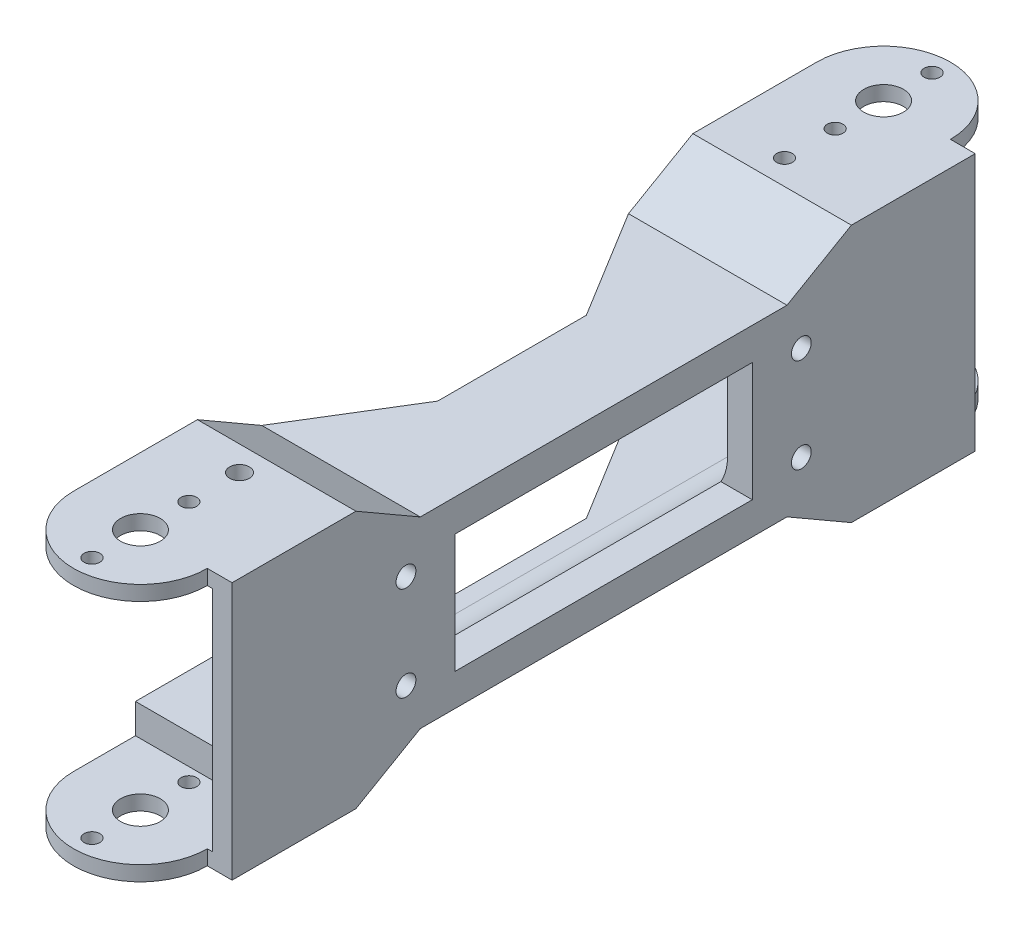
from build123d import *

# Parameters (mm, degrees)
SKETCH1_R                             = 2
BOSS_EXTRUDE1_DEPTH                   = 26
CUT_EXTRUDE1_DEPTH                    = 97.110613358
CUT_EXTRUDE2_DEPTH                    = 97.110613358
CUT_EXTRUDE2_DEPTH_BACK               = 97.110613358
SKETCH4_W                             = 26
SKETCH4_H                             = 6
SKETCH5_W                             = 177
SKETCH5_H                             = 34
CUT_EXTRUDE3_DEPTH                    = 22
SKETCH6_W                             = 22.988088482
SKETCH6_H                             = 34
CUT_EXTRUDE4_DEPTH                    = 95.827474922
SKETCH7_W                             = 22.988088482
SKETCH7_H                             = 34
CUT_EXTRUDE5_DEPTH                    = 95.827474922
F_1_8_0_125_DIAMETER_HOLE1_AT_2_COUNT = 2
F_1_8_0_125_DIAMETER_HOLE1_AT_2_PITCH = 19.558
SKETCH13_R                            = 4
CUT_EXTRUDE6_DEPTH                    = 104.530188834
BOSS_EXTRUDE2_DEPTH                   = 5
SKETCH15_W                            = 125
SKETCH15_H                            = 34
CUT_EXTRUDE7_DEPTH                    = 5
SKETCH17_W                            = 4
SKETCH17_H                            = 52
BOSS_EXTRUDE4_DEPTH                   = 12.5
SKETCH19_R                            = 2
CUT_EXTRUDE11_DEPTH                   = 10
CUT_EXTRUDE8_REACH                    = 106.3
SKETCH18_R                            = 1.5875
SKETCH20_W                            = 60
SKETCH20_H                            = 24
CUT_EXTRUDE10_DEPTH                   = 10
CUT_EXTRUDE12_REACH                   = 102.771
SKETCH22_W                            = 5
SKETCH22_H                            = 46
BOSS_EXTRUDE5_DEPTH                   = 12.5
FILLET1_R                             = 10


with BuildPart() as part:
    # Sketch1 → Boss-Extrude1 (new, symmetric)
    with BuildSketch(Plane(origin=(0, 0, 0), x_dir=(1, 0, 0), z_dir=(0, 1, 0))):
        with BuildLine():
            Line((-13.5, 75), (-13.5, -75))
            ThreePointArc((-13.5, -75), (0, -88.5), (13.5, -75))
            Line((13.5, -75), (13.5, 75))
            ThreePointArc((13.5, 75), (0, 88.5), (-13.5, 75))
        make_face()
        with Locations(Location((0, -55, 0), (0, 0, 90))):
            Circle(SKETCH1_R, mode=Mode.SUBTRACT)
    extrude(amount=BOSS_EXTRUDE1_DEPTH, both=True)

    # Sketch3 → Cut-Extrude1 (cut, symmetric)
    with BuildSketch(Plane.ZY.offset(13.5)):
        Polygon((-50, 26), (-37.009618943, 18.5), (37.009618943, 18.5), (50, 26), align=None)
    cut_extrude1 = extrude(amount=CUT_EXTRUDE1_DEPTH, both=True, mode=Mode.SUBTRACT)

    # Mirror1: Cut-Extrude1 across plane
    add(cut_extrude1.mirror(Plane.ZX), mode=Mode.SUBTRACT)

    # Sketch4 → Cut-Extrude2 (cut, two sides: drawn at the far end of the back side and taken through both)
    with BuildSketch(Plane.ZY.offset(13.5).offset(-CUT_EXTRUDE2_DEPTH_BACK)):
        with Locations((75.5, 20)):
            Rectangle(SKETCH4_W, SKETCH4_H)
        with Locations((-75.5, 20)):
            Rectangle(SKETCH4_W, SKETCH4_H)
        with Locations((-75.5, -20)):
            Rectangle(SKETCH4_W, SKETCH4_H)
        with Locations((75.5, -20)):
            Rectangle(SKETCH4_W, SKETCH4_H)
    extrude(amount=CUT_EXTRUDE2_DEPTH + CUT_EXTRUDE2_DEPTH_BACK, mode=Mode.SUBTRACT)

    # Sketch5 → Cut-Extrude3 (cut)
    with BuildSketch(Plane.ZY.offset(13.5)):
        Rectangle(SKETCH5_W, SKETCH5_H)
    extrude(amount=-CUT_EXTRUDE3_DEPTH, mode=Mode.SUBTRACT)

    # Sketch6 → Cut-Extrude4 (cut, through all)
    with BuildSketch(Plane.ZY.offset(-8.5)):
        with Locations((73.994044241, 0)):
            Rectangle(SKETCH6_W, SKETCH6_H)
    extrude(amount=-CUT_EXTRUDE4_DEPTH, mode=Mode.SUBTRACT)

    # Sketch7 → Cut-Extrude5 (cut, through all)
    with BuildSketch(Plane.ZY.offset(-8.5)):
        with Locations((-73.994044241, 0)):
            Rectangle(SKETCH7_W, SKETCH7_H)
    extrude(amount=-CUT_EXTRUDE5_DEPTH, mode=Mode.SUBTRACT)

    # Sketch12 → 1/8 (0.125) Diameter Hole1 (revolve, cut)
    with BuildSketch(Plane(origin=(0, 26, 65.221), x_dir=(0, 0, 1), z_dir=(1, 0, 0))):
        Polygon((0, 0), (0, 3.953866233), (1.5875, 3), (1.5875, 0), align=None)
    f_1_8_0_125_diameter_hole1 = revolve(axis=Axis((0, 32.35, 65.221), (0, -1, 0)), mode=Mode.SUBTRACT)

    # 1/8 (0.125) Diameter Hole1 at 2: 1/8 (0.125) Diameter Hole1 ×2
    with Locations(*[(0, 0, i * F_1_8_0_125_DIAMETER_HOLE1_AT_2_PITCH) for i in range(1, F_1_8_0_125_DIAMETER_HOLE1_AT_2_COUNT)]):
        add(f_1_8_0_125_diameter_hole1, mode=Mode.SUBTRACT)

    # Mirror5: 1/8 (0.125) Diameter Hole1 across plane
    add(f_1_8_0_125_diameter_hole1.mirror(Plane.ZX), mode=Mode.SUBTRACT)

    # Mirror5 copy 1 sketch → Mirror5 copy 1 (revolve, cut)
    with BuildSketch(Plane(origin=(0, -26, 84.779), x_dir=(0, 0, 1), z_dir=(1, 0, 0))):
        Polygon((0, 0), (0, -3.953866233), (1.5875, -3), (1.5875, 0), align=None)
    revolve(axis=Axis((0, -32.35, 84.779), (0, -1, 0)), mode=Mode.SUBTRACT)

    # Mirror3: 1/8 (0.125) Diameter Hole1 across plane
    add(f_1_8_0_125_diameter_hole1.mirror(Plane.XY), mode=Mode.SUBTRACT)

    # Mirror3 copy 1 sketch → Mirror3 copy 1 (revolve, cut)
    with BuildSketch(Plane(origin=(0, 26, -84.779), x_dir=(0, 0, -1), z_dir=(1, 0, 0))):
        Polygon((0, 0), (0, -3.953866233), (1.5875, -3), (1.5875, 0), align=None)
    revolve(axis=Axis((0, 32.35, -84.779), (0, 1, 0)), mode=Mode.SUBTRACT)

    # Sketch13 → Cut-Extrude6 (cut, symmetric)
    with BuildSketch(Plane.XZ.offset(26)):
        with Locations(Location((0, -75, 0), (0, 0, 270))):
            Circle(SKETCH13_R)
    cut_extrude6 = extrude(amount=CUT_EXTRUDE6_DEPTH, both=True, mode=Mode.SUBTRACT)

    # Mirror4: Cut-Extrude6 across plane
    add(cut_extrude6.mirror(Plane.XY), mode=Mode.SUBTRACT)

    # Sketch14 → Boss-Extrude2 (add)
    with BuildSketch(Plane(origin=(13.5, 0, 0), x_dir=(0, 0, -1), z_dir=(1, 0, 0))):
        Polygon((-75, 26), (-75, 23), (-62.5, 23), (-62.5, -23), (-75, -23), (-75, -26), (-50, -26), (-37.009618943, -18.5), (37.009618943, -18.5), (50, -26), (75, -26), (75, -23), (62.5, -23), (62.5, 23), (75, 23), (75, 26), (50, 26), (37.009618943, 18.5), (-37.009618943, 18.5), (-50, 26), align=None)
    extrude(amount=BOSS_EXTRUDE2_DEPTH)

    # Sketch15 → Cut-Extrude7 (cut)
    with BuildSketch(Plane.ZY.offset(-8.5)):
        Rectangle(SKETCH15_W, SKETCH15_H)
    extrude(amount=-CUT_EXTRUDE7_DEPTH, mode=Mode.SUBTRACT)

    # Sketch17 → Boss-Extrude4 (add)
    with BuildSketch(Plane.XY.offset(62.5)):
        with Locations((16.5, 0)):
            Rectangle(SKETCH17_W, SKETCH17_H)
    extrude(amount=BOSS_EXTRUDE4_DEPTH)

    # Mirror6 copy 1 sketch → Mirror6 copy 1 (revolve, cut)
    with BuildSketch(Plane(origin=(0, -26, -65.221), x_dir=(0, 0, -1), z_dir=(1, 0, 0))):
        Polygon((0, 0), (0, 3.953866233), (1.5875, 3), (1.5875, 0), align=None)
    revolve(axis=Axis((0, -32.35, -65.221), (0, 1, 0)), mode=Mode.SUBTRACT)

    # Mirror6 copy 2 sketch → Mirror6 copy 2 (revolve, cut)
    with BuildSketch(Plane(origin=(0, -26, -84.779), x_dir=(0, 0, -1), z_dir=(1, 0, 0))):
        Polygon((0, 0), (0, 3.953866233), (1.5875, 3), (1.5875, 0), align=None)
    revolve(axis=Axis((0, -32.35, -84.779), (0, 1, 0)), mode=Mode.SUBTRACT)

    # Mirror6 copy 3 sketch → Mirror6 copy 3 (revolve, cut)
    with BuildSketch(Plane(origin=(0, -26, 65.221), x_dir=(0, 0, 1), z_dir=(1, 0, 0))):
        Polygon((0, 0), (0, -3.953866233), (1.5875, -3), (1.5875, 0), align=None)
    revolve(axis=Axis((0, -32.35, 65.221), (0, -1, 0)), mode=Mode.SUBTRACT)

    # Mirror6 copy 4 sketch → Mirror6 copy 4 (revolve, cut)
    with BuildSketch(Plane(origin=(0, -26, 84.779), x_dir=(0, 0, 1), z_dir=(1, 0, 0))):
        Polygon((0, 0), (0, -3.953866233), (1.5875, -3), (1.5875, 0), align=None)
    revolve(axis=Axis((0, -32.35, 84.779), (0, -1, 0)), mode=Mode.SUBTRACT)

    # Sketch19 → Cut-Extrude11 (cut)
    with BuildSketch(Plane(origin=(18.5, 0, 0), x_dir=(0, 0, -1), z_dir=(1, 0, 0))):
        with Locations((-39.898979486, 9.525)):
            Circle(SKETCH19_R)
        with Locations((-39.898979486, -9.525)):
            Circle(SKETCH19_R)
    cut_extrude11 = extrude(amount=-CUT_EXTRUDE11_DEPTH, mode=Mode.SUBTRACT)

    # Cut-Extrude8: up to this face of the body (flat: up to its plane)
    cut_extrude8_end = Plane(part.part.faces().sort_by_distance((1.960443083, -26, -66.805592971))[0])
    # Sketch18 → Cut-Extrude8 (cut, up to the picked face)
    with BuildSketch(Plane(origin=(0, 26, 0), x_dir=(1, 0, 0), z_dir=(0, 1, 0)), mode=Mode.PRIVATE) as cut_extrude8_sk1:
        with Locations(Location((0, 55, 0), (0, 0, 270))):
            Circle(SKETCH18_R)
    cut_extrude8_tool1 = split(extrude(cut_extrude8_sk1.sketch, amount=-CUT_EXTRUDE8_REACH, mode=Mode.PRIVATE), bisect_by=cut_extrude8_end, keep=Keep.BOTH, mode=Mode.PRIVATE)
    add(cut_extrude8_tool1.solids().sort_by(Axis((0, 26, -55), (0, -1, 0)))[0], mode=Mode.SUBTRACT)

    # Sketch20 → Cut-Extrude10 (cut)
    with BuildSketch(Plane.ZY.offset(-13.5)):
        Rectangle(SKETCH20_W, SKETCH20_H)
    extrude(amount=-CUT_EXTRUDE10_DEPTH, mode=Mode.SUBTRACT)

    # Mirror7: Cut-Extrude11 across plane
    add(cut_extrude11.mirror(Plane.XY), mode=Mode.SUBTRACT)

    # Sketch21 → Cut-Extrude12 (cut, up to next)
    with BuildSketch(Plane(origin=(0, 18.5, 0), x_dir=(1, 0, 0), z_dir=(0, 1, 0)), mode=Mode.PRIVATE) as cut_extrude12_sk1:
        Polygon((-13.5, 37.009618943), (0, 15), (0, -15), (-13.5, -37.009618943), align=None)
    cut_extrude12_tool1 = extrude(cut_extrude12_sk1.sketch, amount=-CUT_EXTRUDE12_REACH, mode=Mode.PRIVATE) & part.part
    add(cut_extrude12_tool1.solids().sort_by_distance((-7.702163, 18.5, 0))[0], mode=Mode.SUBTRACT)
    add(cut_extrude12_tool1.solids().sort_by_distance((-7.702163, 18.5, 0))[1], mode=Mode.SUBTRACT)

    # Sketch22 → Boss-Extrude5 (add)
    with BuildSketch(Plane(origin=(0, 0, -62.5), x_dir=(-1, 0, 0), z_dir=(0, 0, -1))):
        with Locations((-16, 0)):
            Rectangle(SKETCH22_W, SKETCH22_H)
    extrude(amount=BOSS_EXTRUDE5_DEPTH)

    # Fillet1
    # the kernel refuses this fillet: 10 mm, written as the material it adds along each edge
    with BuildSketch(Plane(origin=(13.5, 17, -62.5), x_dir=(0, -1, 0), z_dir=(0, 0, 1))) as fillet1_piece_1_section:
        with BuildLine():
            CenterArc((FILLET1_R, -FILLET1_R), FILLET1_R, 90, 90)
            Line((0, -FILLET1_R), (0, 0))
            Line((0, 0), (FILLET1_R, 0))
        make_face()
    fillet1_piece_1 = extrude(amount=150, mode=Mode.PRIVATE)
    fillet1_piece_1 = fillet1_piece_1 - Plane(origin=(13.095089825, 9.525, -39.898979486), x_dir=(0, 0, 1), z_dir=(1, 0, 0)) * Cylinder(2, 341, mode=Mode.PRIVATE)
    fillet1_piece_1 = split(fillet1_piece_1, bisect_by=Plane(origin=(13.095089825, 10.807057583, -30), z_dir=(0, 0, -1)), keep=Keep.TOP, mode=Mode.PRIVATE)
    add(fillet1_piece_1)
    with BuildSketch(Plane(origin=(13.5, 17, -62.5), x_dir=(0, -1, 0), z_dir=(0, 0, 1))) as fillet1_piece_2_section:
        with BuildLine():
            CenterArc((FILLET1_R, -FILLET1_R), FILLET1_R, 90, 90)
            Line((0, -FILLET1_R), (0, 0))
            Line((0, 0), (FILLET1_R, 0))
        make_face()
    fillet1_piece_2 = extrude(amount=125, mode=Mode.PRIVATE)
    fillet1_piece_2 = split(fillet1_piece_2, bisect_by=Plane(origin=(11.059751506, 12, 0), z_dir=(0, 1, 0)), keep=Keep.TOP, mode=Mode.PRIVATE)
    add(fillet1_piece_2)
    with BuildSketch(Plane(origin=(13.5, 17, -87.5), x_dir=(0, -1, 0), z_dir=(0, 0, 1))) as fillet1_piece_3_section:
        with BuildLine():
            CenterArc((FILLET1_R, -FILLET1_R), FILLET1_R, 90, 90)
            Line((0, -FILLET1_R), (0, 0))
            Line((0, 0), (FILLET1_R, 0))
        make_face()
    fillet1_piece_3 = extrude(amount=150, mode=Mode.PRIVATE)
    fillet1_piece_3 = fillet1_piece_3 - Plane(origin=(13.095089825, 9.525, 39.898979486), x_dir=(0, 0, -1), z_dir=(1, 0, 0)) * Cylinder(2, 341, mode=Mode.PRIVATE)
    fillet1_piece_3 = split(fillet1_piece_3, bisect_by=Plane(origin=(13.095089825, 10.807057583, 30), z_dir=(0, 0, 1)), keep=Keep.TOP, mode=Mode.PRIVATE)
    add(fillet1_piece_3)
    with BuildSketch(Plane(origin=(13.5, -17, 62.5), x_dir=(-1, 0, 0), z_dir=(0, 0, -1))) as fillet1_piece_4_section:
        with BuildLine():
            CenterArc((FILLET1_R, FILLET1_R), FILLET1_R, 180, 90)
            Line((0, FILLET1_R), (0, 0))
            Line((0, 0), (FILLET1_R, 0))
        make_face()
    fillet1_piece_4 = extrude(amount=125, mode=Mode.PRIVATE)
    fillet1_piece_4 = split(fillet1_piece_4, bisect_by=Plane(origin=(11.059751506, -12, 46.25), z_dir=(0, -1, 0)), keep=Keep.TOP, mode=Mode.PRIVATE)
    add(fillet1_piece_4)
    with BuildSketch(Plane(origin=(13.5, -17, 62.5), x_dir=(-1, 0, 0), z_dir=(0, 0, -1))) as fillet1_piece_5_section:
        with BuildLine():
            CenterArc((FILLET1_R, FILLET1_R), FILLET1_R, 180, 90)
            Line((0, FILLET1_R), (0, 0))
            Line((0, 0), (FILLET1_R, 0))
        make_face()
    fillet1_piece_5 = extrude(amount=150, mode=Mode.PRIVATE)
    fillet1_piece_5 = split(fillet1_piece_5, bisect_by=Plane(origin=(13.095085978, -10.807036513, 30), z_dir=(0, 0, 1)), keep=Keep.TOP, mode=Mode.PRIVATE)
    fillet1_piece_5 = fillet1_piece_5 - Plane(origin=(13.095085978, -9.525, 39.898979486), x_dir=(0, 0, -1), z_dir=(1, 0, 0)) * Cylinder(2, 341, mode=Mode.PRIVATE)
    add(fillet1_piece_5)
    with BuildSketch(Plane(origin=(13.5, -17, 87.5), x_dir=(-1, 0, 0), z_dir=(0, 0, -1))) as fillet1_piece_6_section:
        with BuildLine():
            CenterArc((FILLET1_R, FILLET1_R), FILLET1_R, 180, 90)
            Line((0, FILLET1_R), (0, 0))
            Line((0, 0), (FILLET1_R, 0))
        make_face()
    fillet1_piece_6 = extrude(amount=150, mode=Mode.PRIVATE)
    fillet1_piece_6 = split(fillet1_piece_6, bisect_by=Plane(origin=(13.095085978, -10.807036513, -30), z_dir=(0, 0, -1)), keep=Keep.TOP, mode=Mode.PRIVATE)
    fillet1_piece_6 = fillet1_piece_6 - Plane(origin=(13.095085978, -9.525, -39.898979486), x_dir=(0, 0, 1), z_dir=(1, 0, 0)) * Cylinder(2, 341, mode=Mode.PRIVATE)
    add(fillet1_piece_6)


solid = part.part
